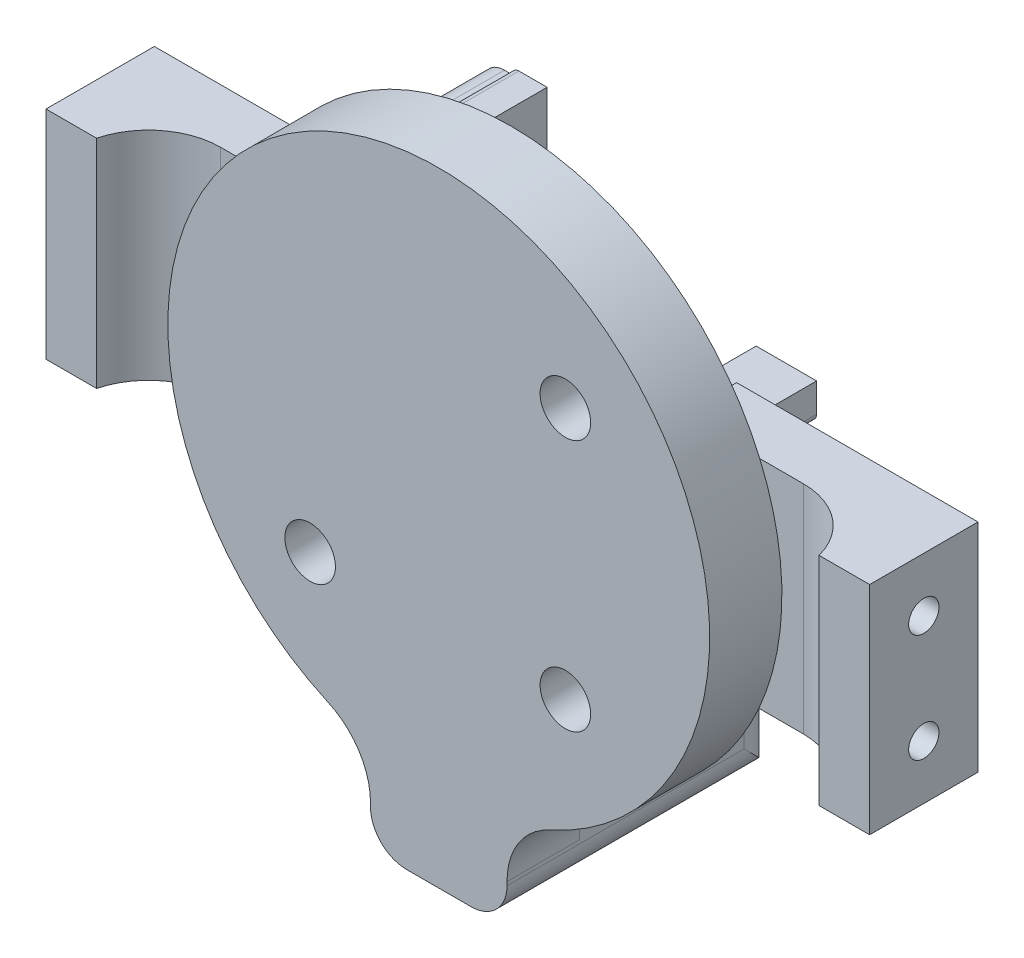
from build123d import *

# Parameters (mm, degrees)
SKETCH1_R                                            = 37.5
BOSS_EXTRUDE1_DEPTH                                  = 10
CSK_FOR_M6_HEX_SOCKET_COUNTERSUNK_CAP_SC_D           = 7
CSK_FOR_M6_HEX_SOCKET_COUNTERSUNK_CAP_SC_DEPTH       = 14.44
CSK_FOR_M6_HEX_SOCKET_COUNTERSUNK_CAP_SC_CSINK_D     = 13.44
CSK_FOR_M6_HEX_SOCKET_COUNTERSUNK_CAP_SC_CSINK_ANGLE = 90
CSK_FOR_M6_HEX_SOCKET_COUNTERSUNK_CAP_SC_TIP         = 2.103012167
SKETCH6_W                                            = 15
SKETCH6_H                                            = 30
BOSS_EXTRUDE2_DEPTH                                  = 7
SKETCH7_W                                            = 15
SKETCH7_H                                            = 30
BOSS_EXTRUDE3_DEPTH                                  = 7
BOSS_EXTRUDE4_START                                  = -7.5
BOSS_EXTRUDE4_DEPTH                                  = 7.5
FILLET1_R                                            = 10
SKETCH9_R                                            = 2.1
CUT_EXTRUDE1_DEPTH                                   = 6
SKETCH11_R                                           = 2.1
BOSS_EXTRUDE5_DEPTH                                  = 25
SKETCH12_W                                           = 3.472021997
SKETCH12_H                                           = 10.744400241
CUT_EXTRUDE2_DEPTH                                   = 25
BOSS_EXTRUDE7_DEPTH                                  = 10
SKETCH15_4_W                                         = 18.896565648
SKETCH15_4_H                                         = 10
BOSS_EXTRUDE8_DEPTH                                  = 27.8
F_1_4_0_25_DIAMETER_HOLE2_D                          = 6.35
F_1_4_0_25_DIAMETER_HOLE2_DEPTH                      = 15
F_1_4_0_25_DIAMETER_HOLE2_TIP                        = 1.907732465
SKETCH24_W                                           = 18.896565648
SKETCH24_H                                           = 23.705231447
BOSS_EXTRUDE9_DEPTH                                  = 11.55
FILLET2_R                                            = 10
FILLET4_R                                            = 5


with BuildPart() as part:
    # Sketch1 → Boss-Extrude1 (new body)
    with BuildSketch(Plane.XY):
        with Locations((-0.136852044, 0.136852044)):
            Circle(SKETCH1_R)
    extrude(amount=BOSS_EXTRUDE1_DEPTH)

    # CSK for M6 Hex Socket Countersunk Cap Screw1
    with Locations(Plane(origin=(0, 0, 0), x_dir=(-1, 0, 0), z_dir=(0, 0, -1))):
        with Locations((-17.388332087, 17.58954996), (-17.388332087, -17.337031875), (17.941484165, -17.337031875)):
            CounterSinkHole(CSK_FOR_M6_HEX_SOCKET_COUNTERSUNK_CAP_SC_D / 2, CSK_FOR_M6_HEX_SOCKET_COUNTERSUNK_CAP_SC_CSINK_D / 2, depth=CSK_FOR_M6_HEX_SOCKET_COUNTERSUNK_CAP_SC_DEPTH, counter_sink_angle=CSK_FOR_M6_HEX_SOCKET_COUNTERSUNK_CAP_SC_CSINK_ANGLE)
            with Locations((0, 0, -(CSK_FOR_M6_HEX_SOCKET_COUNTERSUNK_CAP_SC_DEPTH + CSK_FOR_M6_HEX_SOCKET_COUNTERSUNK_CAP_SC_TIP / 2))):  # 118° drill point
                Cone(0, CSK_FOR_M6_HEX_SOCKET_COUNTERSUNK_CAP_SC_D / 2, CSK_FOR_M6_HEX_SOCKET_COUNTERSUNK_CAP_SC_TIP, mode=Mode.SUBTRACT)



with BuildPart() as body_2:
    # Sketch6 → Boss-Extrude2 (new body)
    with BuildSketch(Plane(origin=(50, 0, 0), x_dir=(0, 0, -1), z_dir=(1, 0, 0))):
        Rectangle(SKETCH6_W, SKETCH6_H)
    extrude(amount=BOSS_EXTRUDE2_DEPTH)


with BuildPart() as body_3:
    # Sketch7 → Boss-Extrude3 (new body)
    with BuildSketch(Plane(origin=(-50, 0, 0), x_dir=(0, 0, -1), z_dir=(1, 0, 0))):
        Rectangle(SKETCH7_W, SKETCH7_H)
    extrude(amount=-BOSS_EXTRUDE3_DEPTH)


with BuildPart() as part_1:
    add(part.part)

    add(body_2.part)  # Boss-Extrude4 merges body 2

    add(body_3.part)  # Boss-Extrude4 merges body 3
    # Sketch8 → Boss-Extrude4 (add)
    with BuildSketch(Plane(origin=(0, 0, -7.5), x_dir=(-1, 0, 0), z_dir=(0, 0, -1)).offset(BOSS_EXTRUDE4_START)):
        with BuildLine():
            Line((-34.291869002, 15), (-57, 15))
            Line((-57, 15), (-57, -15))
            Line((-57, -15), (-34.172413618, -15))
            Line((-34.172413618, -15), (-23.688862383, -15))
            ThreePointArc((-23.688862383, -15), (-17.388332087, -10.617031875), (-11.087801791, -15))
            Line((-11.087801791, -15), (11.640953869, -15))
            ThreePointArc((11.640953869, -15), (17.941484165, -10.617031875), (24.242014462, -15))
            Line((24.242014462, -15), (34.446117705, -15))
            Line((34.446117705, -15), (57, -15))
            Line((57, -15), (57, 15))
            Line((57, 15), (34.565573089, 15))
            Line((34.565573089, 15), (24.142502711, 15))
            Line((24.142502711, 15), (11.74046562, 15))
            Line((11.74046562, 15), (-11.187313541, 15))
            ThreePointArc((-11.187313541, 15), (-17.388332087, 10.86954996), (-23.589350633, 15))
            Line((-23.589350633, 15), (-34.291869002, 15))
        make_face()
    extrude(amount=BOSS_EXTRUDE4_DEPTH)

    # Fillet1
    # the kernel refuses this fillet: 10 mm, written as the material it adds along each edge
    with BuildSketch(Plane(origin=(-50, -15, 0), x_dir=(0, 0, 1), z_dir=(0, 1, 0))) as fillet1_piece_1:
        with BuildLine():
            CenterArc((10, 9.682458366), FILLET1_R, 180, 75.522487814)
            Line((0, 9.682458366), (-0.2, 9.682458366))
            Line((-0.2, 9.682458366), (-0.2, 0))
            Line((-0.2, 0), (0, -0.2))
            ThreePointArc((0, -0.2), (3.75, -0.2), (7.45, -0.193649167))
            Line((7.45, -0.193649167), (7.5, 0))
        make_face()
    extrude(amount=30)
    with BuildSketch(Plane(origin=(50, -15, 0), x_dir=(0, 0, 1), z_dir=(0, 1, 0))) as fillet1_piece_2:
        with BuildLine():
            CenterArc((10, -9.682458366), FILLET1_R, 104.477512186, 75.522487814)
            Line((0, -9.682458366), (-0.2, -9.682458366))
            Line((-0.2, -9.682458366), (-0.2, 0))
            Line((-0.2, 0), (0, 0.2))
            ThreePointArc((0, 0.2), (3.75, 0.2), (7.45, 0.193649167))
            Line((7.45, 0.193649167), (7.5, 0))
        make_face()
    extrude(amount=30)

    # Sketch9 → Cut-Extrude1 (cut)
    with BuildSketch(Plane(origin=(57, 0, 0), x_dir=(0, 0, -1), z_dir=(1, 0, 0))):
        with Locations((0, -7.5)):
            Circle(SKETCH9_R)
        with Locations((0, 7.5)):
            Circle(SKETCH9_R)
    cut_extrude1 = extrude(amount=-CUT_EXTRUDE1_DEPTH, mode=Mode.SUBTRACT)

    # Mirror1: Cut-Extrude1 across plane
    add(cut_extrude1.mirror(Plane(origin=(0, 0, 0), x_dir=(0, 0, 1), z_dir=(1, 0, 0))), mode=Mode.SUBTRACT)

    # Sketch11 → Boss-Extrude5 (add)
    # profile 1 of 2: a face of its own
    with BuildSketch(Plane(origin=(0, 0, -7.5), x_dir=(-1, 0, 0), z_dir=(0, 0, -1))):
        with BuildLine():
            Line((27.636852044, 12.286852044), (27.636852044, -12.013147956))
            Line((27.636852044, -12.013147956), (31.536852044, -12.013147956))
            ThreePointArc((31.536852044, -12.013147956), (32.243958825, -11.720254738), (32.536852044, -11.013147956))
            Line((32.536852044, -11.013147956), (33.536852044, -11.013147956))
            ThreePointArc((33.536852044, -11.013147956), (35.658172387, -10.1344683), (36.536852044, -8.013147956))
            Line((36.536852044, -8.013147956), (36.536852044, -6.013147956))
            ThreePointArc((36.536852044, -6.013147956), (35.658172387, -3.891827613), (33.536852044, -3.013147956))
            Line((33.536852044, -3.013147956), (32.536852044, -3.013147956))
            Line((32.536852044, -3.013147956), (32.536852044, 3.386852044))
            Line((32.536852044, 3.386852044), (33.536852044, 3.386852044))
            ThreePointArc((33.536852044, 3.386852044), (35.658172387, 4.2655317), (36.536852044, 6.386852044))
            Line((36.536852044, 6.386852044), (36.536852044, 8.386852044))
            ThreePointArc((36.536852044, 8.386852044), (35.658172387, 10.508172387), (33.536852044, 11.386852044))
            Line((33.536852044, 11.386852044), (32.531839481, 11.386852044))
            ThreePointArc((32.531839481, 11.386852044), (32.207672437, 12.028471892), (31.536852044, 12.286852044))
            Line((31.536852044, 12.286852044), (27.636852044, 12.286852044))
        make_face()
        with Locations((32.437183431, -7.013147956)):
            Circle(SKETCH11_R, mode=Mode.SUBTRACT)
        with Locations((32.437183431, 7.386852044)):
            Circle(SKETCH11_R, mode=Mode.SUBTRACT)
    # profile 2 of 2: a face of its own
    with BuildSketch(Plane(origin=(0, 0, -7.5), x_dir=(-1, 0, 0), z_dir=(0, 0, -1))):
        with BuildLine():
            Line((0.436852044, -12.013147956), (0.436852044, -4.263147956))
            Line((0.436852044, -4.263147956), (-9.663147956, -4.263147956))
            Line((-9.663147956, -4.263147956), (-9.663147956, -8.263147956))
            ThreePointArc((-9.663147956, -8.263147956), (-9.370254738, -8.970254738), (-8.663147956, -9.263147956))
            Line((-8.663147956, -9.263147956), (-7.856041175, -9.263147956))
            Line((-7.856041175, -9.263147956), (-7.856041175, -9.656041175))
            ThreePointArc((-7.856041175, -9.656041175), (-6.977361519, -11.777361519), (-4.856041175, -12.656041175))
            Line((-4.856041175, -12.656041175), (-3.511855719, -12.656041175))
            ThreePointArc((-3.511855719, -12.656041175), (-2.52984766, -12.490765178), (-1.656041175, -12.013147956))
            Line((-1.656041175, -12.013147956), (0.436852044, -12.013147956))
        make_face()
        with Locations((-4.016957243, -8.560264433)):
            Circle(SKETCH11_R, mode=Mode.SUBTRACT)
    extrude(amount=BOSS_EXTRUDE5_DEPTH)

    # Sketch12 → Cut-Extrude2 (cut)
    with BuildSketch(Plane(origin=(0, 0, -32.5), x_dir=(-1, 0, 0), z_dir=(0, 0, -1))):
        with Locations((0.436852044, -4.263147957)):
            Rectangle(SKETCH12_W, SKETCH12_H)
    extrude(amount=-CUT_EXTRUDE2_DEPTH, mode=Mode.SUBTRACT)

    # Sketch15 → Boss-Extrude7 (add)
    with BuildSketch(Plane(origin=(0, 0, 0), x_dir=(-1, 0, 0), z_dir=(0, 0, -1))):
        with BuildLine():
            ThreePointArc((9.585134895, -36.153366351), (0.136852072, -37.363147956), (-9.311430753, -36.153366366))
            Line((-9.311430753, -36.153366366), (-9.311430753, -48.705231447))
            Line((-9.311430753, -48.705231447), (9.585134895, -48.705231447))
            Line((9.585134895, -48.705231447), (9.585134895, -36.153366351))
        make_face()
    extrude(amount=-BOSS_EXTRUDE7_DEPTH)

    # Sketch15<4> → Boss-Extrude8 (add)
    with BuildSketch(Plane(origin=(0, 0, 0), x_dir=(-1, 0, 0), z_dir=(0, 0, -1))):
        with Locations((0.136852071, -43.705231447)):
            Rectangle(SKETCH15_4_W, SKETCH15_4_H)
    extrude(amount=BOSS_EXTRUDE8_DEPTH)

    # 1/4 (0.25) Diameter Hole2
    with Locations(Plane(origin=(0, -48.705231447, 0), x_dir=(-1, 0, 0), z_dir=(0, -1, 0))):
        with Locations((0.136852046, 21.7)):
            Hole(F_1_4_0_25_DIAMETER_HOLE2_D / 2, depth=F_1_4_0_25_DIAMETER_HOLE2_DEPTH)
            with Locations((0, 0, -(F_1_4_0_25_DIAMETER_HOLE2_DEPTH + F_1_4_0_25_DIAMETER_HOLE2_TIP / 2))):  # 118° drill point
                Cone(0, F_1_4_0_25_DIAMETER_HOLE2_D / 2, F_1_4_0_25_DIAMETER_HOLE2_TIP, mode=Mode.SUBTRACT)

    # Sketch24 → Boss-Extrude9 (add)
    with BuildSketch(Plane(origin=(0, 0, 0), x_dir=(-1, 0, 0), z_dir=(0, 0, -1))):
        with Locations((0.136852071, -26.852615724)):
            Rectangle(SKETCH24_W, SKETCH24_H)
    extrude(amount=BOSS_EXTRUDE9_DEPTH)

    # Fillet2
    fillet2_edges = [part_1.edges().sort_by_distance(p)[0] for p in [
        (-9.585134895, -36.153366351, 5),
        (9.311430753, -36.153366366, 5),
    ]]
    fillet(fillet2_edges, radius=FILLET2_R)

    # Fillet4
    fillet4_edges = [part_1.edges().sort_by_distance(p)[0] for p in [
        (9.311430753, -48.705231447, -8.9),
        (-9.585134895, -48.705231447, -8.9),
        (-9.585134895, -43.705231447, -27.8),
        (9.311430753, -43.705231447, -27.8),
    ]]
    fillet(fillet4_edges, radius=FILLET4_R)


solid = part_1.part
